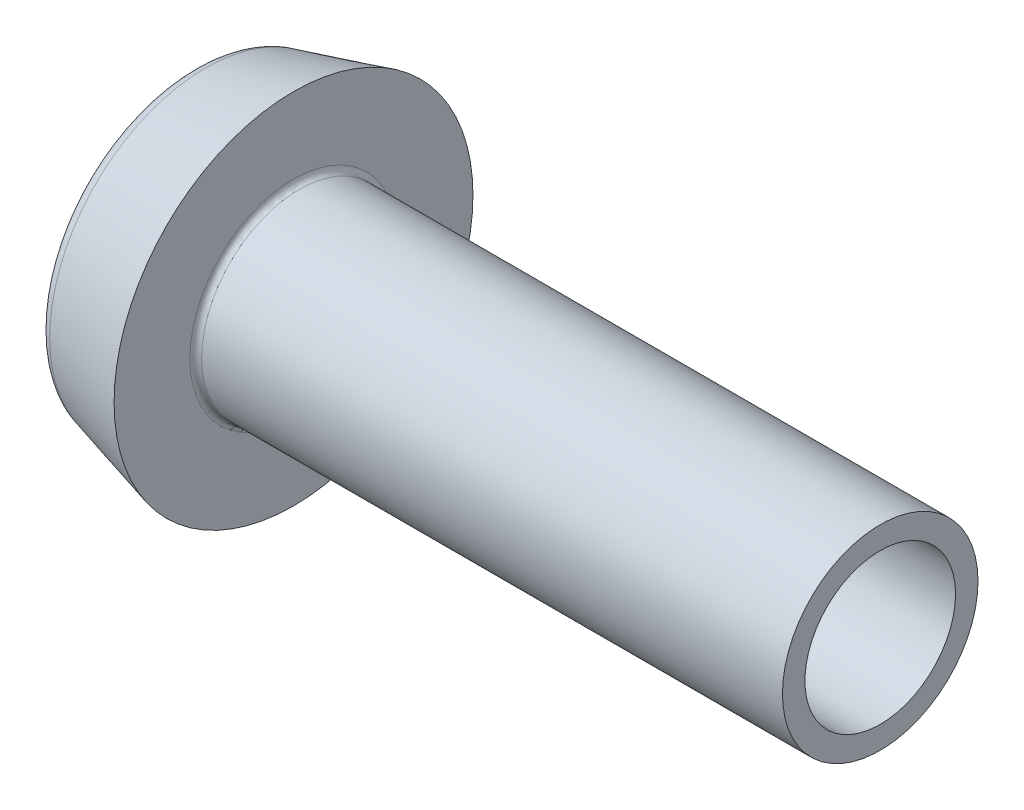
from build123d import *


with BuildPart() as part:
    # Sketch1 → Base-Revolve (revolve)
    with BuildSketch(Plane.XY):
        with BuildLine():
            Line((35.24, 0), (35.24, 5))
            Line((35.24, 5), (5.54, 5))
            ThreePointArc((5.54, 5), (5.327867966, 5.087867966), (5.24, 5.3))
            Line((5.24, 5.3), (5.24, 9.175))
            Line((5.24, 9.175), (0.741180955, 7.96954507))
            ThreePointArc((0.741180955, 7.96954507), (0.20664666, 7.612380673), (0, 7.003619244))
            Line((0, 7.003619244), (0, 0))
            Line((0, 0), (35.24, 0))
        make_face()
    revolve(axis=Axis((-47.217039106, 0, 0), (1, 0, 0)))

    # Sketch2 → Cut-Revolve1 (revolve, cut)
    with BuildSketch(Plane.XY):
        Polygon((35.24, 0), (35.24, 3.85), (25.61, 3.85), (22.812811267, 0), align=None)
    revolve(axis=Axis((1.356225947, 0, 0), (-1, 0, 0)), mode=Mode.SUBTRACT)


solid = part.part
